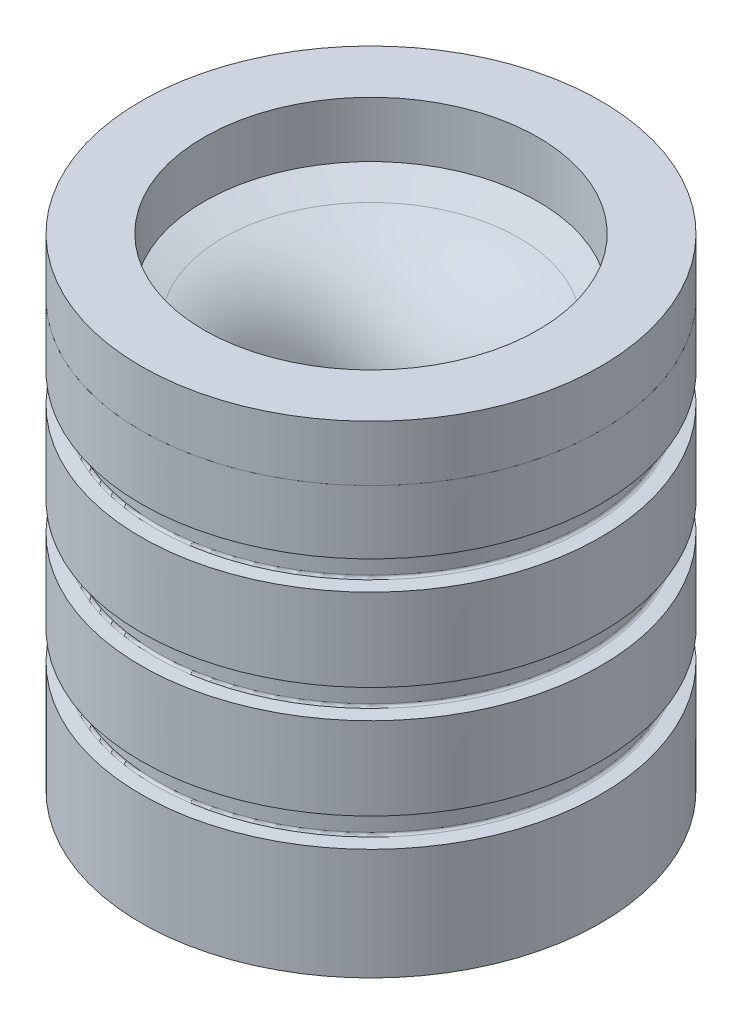
from build123d import *

# Parameters (mm, degrees)
SKETCH1_R           = 41.275
SKETCH1_R_2         = 30
BOSS_EXTRUDE1_DEPTH = 10


# Read off the part's stored shape, not the designer's step: Nozzle_rev2
with BuildPart() as part:
    # Nozzle_rev2 outline → Nozzle_rev2 (revolve)
    with BuildSketch(Plane(origin=(-1.061217108, 0, 20.710635557), x_dir=(1, 0, 0), z_dir=(0, 0, 1))):
        with BuildLine():
            Line((41.275, 15.519793134), (41.275, 30.347660732))
            Line((41.275, 30.347660732), (38.861359272, 30.558826933))
            ThreePointArc((38.861359272, 30.558826933), (38.572380224, 30.701335629), (38.4556, 31.001635476))
            Line((38.4556, 31.001635476), (38.4556, 34.86581839))
            ThreePointArc((38.4556, 34.86581839), (38.572380224, 35.166118237), (38.861359272, 35.308626933))
            Line((38.861359272, 35.308626933), (41.275, 35.519793134))
            Line((41.275, 35.519793134), (41.275, 46.930680607))
            Line((41.275, 46.930680607), (26.580981008, 42.993430084))
            ThreePointArc((26.580981008, 42.993430084), (13.222441117, 32.743061906), (11.024631822, 16.049042913))
            Line((11.024631822, 16.049042913), (23.27236431, -29.660117011))
            Line((23.27236431, -29.660117011), (41.275, -29.660117011))
            Line((41.275, -29.660117011), (41.275, -9.652339268))
            Line((41.275, -9.652339268), (38.861359272, -9.441173067))
            ThreePointArc((38.861359272, -9.441173067), (38.572380224, -9.298664371), (38.4556, -8.998364524))
            Line((38.4556, -8.998364524), (38.4556, -5.13418161))
            ThreePointArc((38.4556, -5.13418161), (38.572380224, -4.833881763), (38.861359272, -4.691373067))
            Line((38.861359272, -4.691373067), (41.275, -4.480206866))
            Line((41.275, -4.480206866), (41.275, 10.347660732))
            Line((41.275, 10.347660732), (38.861359272, 10.558826933))
            ThreePointArc((38.861359272, 10.558826933), (38.572380224, 10.701335629), (38.4556, 11.001635476))
            Line((38.4556, 11.001635476), (38.4556, 14.86581839))
            ThreePointArc((38.4556, 14.86581839), (38.572380224, 15.166118237), (38.861359272, 15.308626933))
            Line((38.861359272, 15.308626933), (41.275, 15.519793134))
        make_face()
    revolve(axis=Axis((-1.061217108, 0, 20.710635557), (0, 1, 0)))


with BuildPart() as body_2:
    # Sketch1 → Boss-Extrude1 (new body)
    with BuildSketch(Plane(origin=(0, 46.930680607, 0), x_dir=(1, 0, 0), z_dir=(0, 1, 0))):
        with Locations(Location((-1.061217108, -20.710635557, 0), (0, 0, 270))):
            Circle(SKETCH1_R)
        with Locations(Location((-1.061217108, -20.710635557, 0), (0, 0, 270))):
            Circle(SKETCH1_R_2, mode=Mode.SUBTRACT)
    extrude(amount=BOSS_EXTRUDE1_DEPTH)


solid = Compound([part.part, body_2.part])
